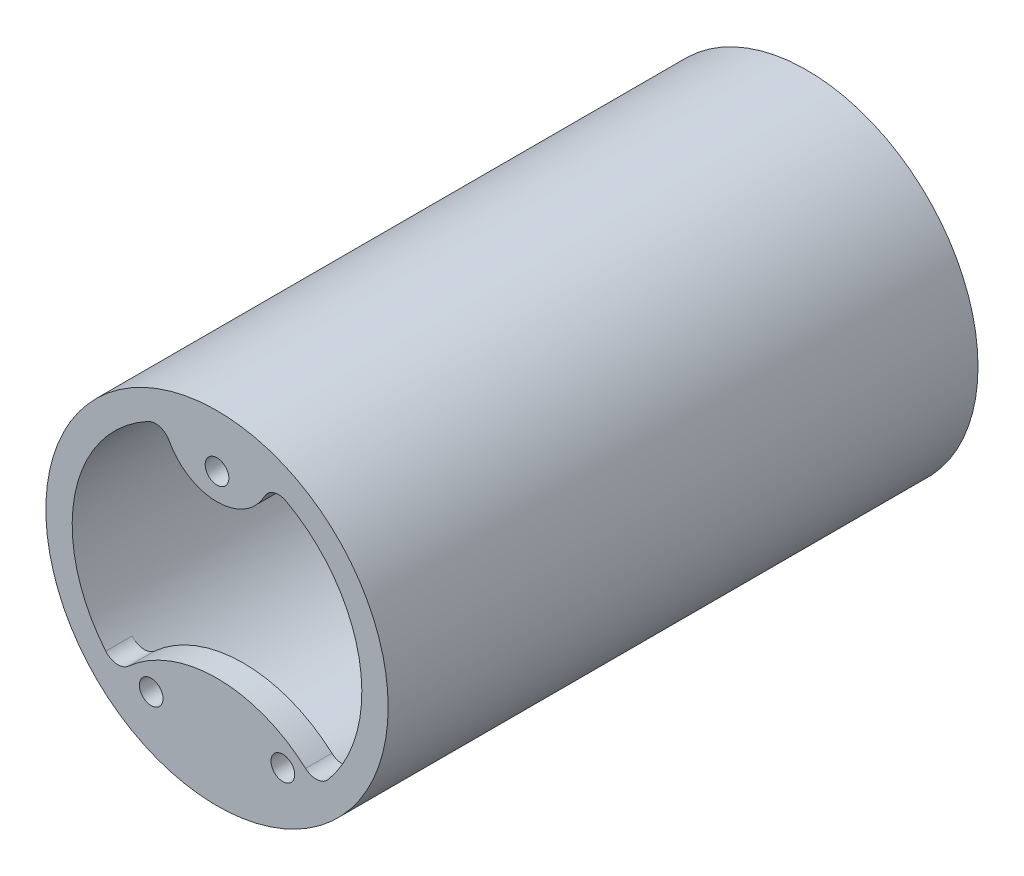
from build123d import *

# Parameters (mm, degrees)
CROQUIS1_R          = 32.5
CROQUIS1_R_2        = 27.5
BOSS_EXTRUDE1_DEPTH = 112
SKETCH1_R           = 1.5
CUT_EXTRUDE1_DEPTH  = 5
BOSS_EXTRUDE4_START = -5
BOSS_EXTRUDE4_DEPTH = 5
SKETCH2_R           = 2.25
CUT_EXTRUDE2_DEPTH  = 5
FILLET1_R           = 3


with BuildPart() as part:
    # Croquis1 → Boss-Extrude1 (new body)
    with BuildSketch(Plane.XY):
        Circle(CROQUIS1_R)
        Circle(CROQUIS1_R_2, mode=Mode.SUBTRACT)
    extrude(amount=BOSS_EXTRUDE1_DEPTH)

    # Sketch1 → Cut-Extrude1 (cut)
    with BuildSketch(Plane(origin=(0, 0, 0), x_dir=(-1, 0, 0), z_dir=(0, 0, -1))):
        with Locations((-30, 0)):
            Circle(SKETCH1_R)
        with Locations((0, 30)):
            Circle(SKETCH1_R)
        with Locations((30, 0)):
            Circle(SKETCH1_R)
        with Locations((0, -30)):
            Circle(SKETCH1_R)
    extrude(amount=-CUT_EXTRUDE1_DEPTH, mode=Mode.SUBTRACT)

    # Sketch4 → Boss-Extrude4 (add)
    with BuildSketch(Plane.XY.offset(112).offset(BOSS_EXTRUDE4_START)):
        with BuildLine():
            ThreePointArc((-10, 25.617376915), (0, 17.5), (10, 25.617376915))
            ThreePointArc((10, 25.617376915), (0, 27.5), (-10, 25.617376915))
        make_face()
        with BuildLine():
            ThreePointArc((-18.874586088, -20), (0, -11.5), (18.874586088, -20))
            ThreePointArc((18.874586088, -20), (0, -27.5), (-18.874586088, -20))
        make_face()
    extrude(amount=BOSS_EXTRUDE4_DEPTH)

    # Sketch2 → Cut-Extrude2 (cut)
    with BuildSketch(Plane.XY.offset(112)):
        with Locations((-12.5, -20)):
            Circle(SKETCH2_R)
        with Locations((12.5, -20)):
            Circle(SKETCH2_R)
        with Locations((0, 22.5)):
            Circle(SKETCH2_R)
    extrude(amount=-CUT_EXTRUDE2_DEPTH, mode=Mode.SUBTRACT)

    # Fillet1
    fillet1_edges = [part.edges().sort_by_distance(p)[0] for p in [
        (18.874586088, -20, 109.5),
        (-18.874586088, -20, 109.5),
        (10, 25.617376915, 109.5),
        (-10, 25.617376915, 109.5),
    ]]
    fillet(fillet1_edges, radius=FILLET1_R)


solid = part.part
